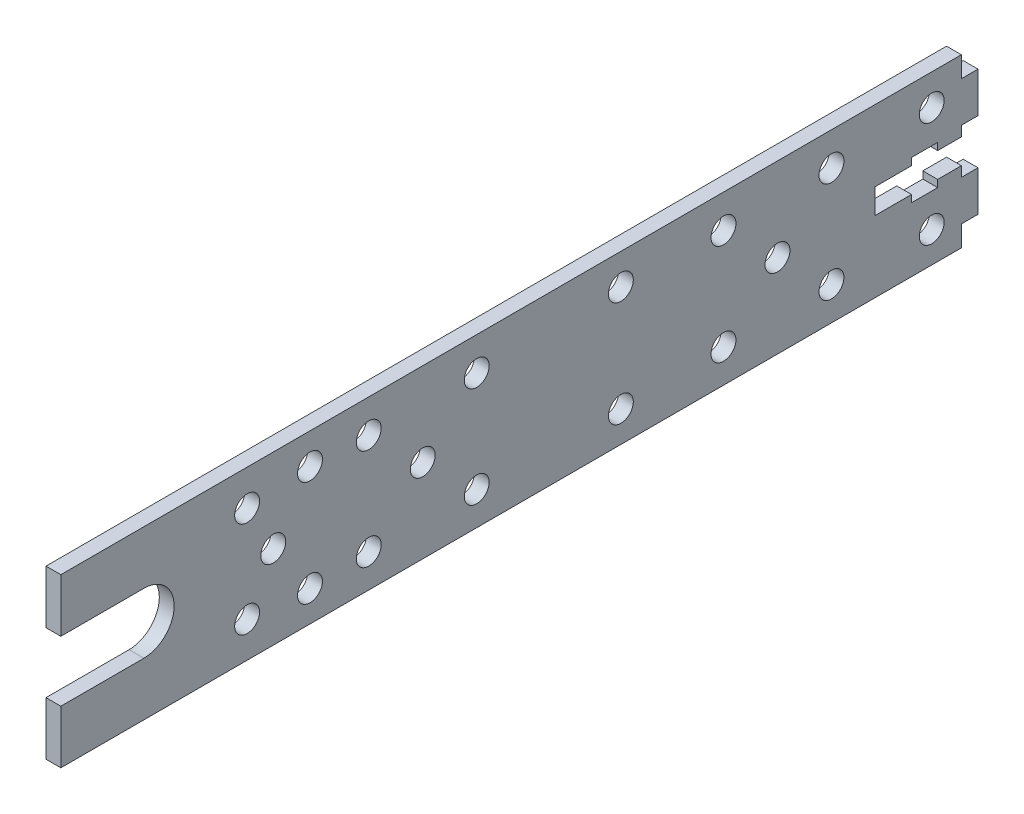
from build123d import *

# Parameters (mm, degrees)
SKETCH1_R           = 2.667
BOSS_EXTRUDE1_DEPTH = 1.5875


with BuildPart() as part:
    # Sketch1 → Boss-Extrude1 (new, symmetric)
    with BuildSketch(Plane(origin=(0, 0, 0), x_dir=(0, 0, -1), z_dir=(1, 0, 0))):
        with BuildLine():
            Line((94.615, 17.907), (-98.171, 17.907))
            Line((-98.171, 17.907), (-98.171, 6.477))
            Line((-98.171, 6.477), (-80.391, 6.477))
            ThreePointArc((-80.391, 6.477), (-73.914, 0), (-80.391, -6.477))
            Line((-80.391, -6.477), (-98.171, -6.477))
            Line((-98.171, -6.477), (-98.171, -17.907))
            Line((-98.171, -17.907), (94.615, -17.907))
            Line((94.615, -17.907), (94.615, -13.462))
            Line((94.615, -13.462), (98.171, -13.462))
            Line((98.171, -13.462), (98.171, -4.826))
            Line((98.171, -4.826), (94.615, -4.826))
            Line((94.615, -4.826), (94.615, -2.667))
            Line((94.615, -2.667), (89.535, -2.667))
            Line((89.535, -2.667), (89.535, -4.191))
            Line((89.535, -4.191), (83.947, -4.191))
            Line((83.947, -4.191), (83.947, -2.667))
            Line((83.947, -2.667), (76.073, -2.667))
            Line((76.073, -2.667), (76.073, 2.667))
            Line((76.073, 2.667), (83.947, 2.667))
            Line((83.947, 2.667), (83.947, 4.191))
            Line((83.947, 4.191), (89.535, 4.191))
            Line((89.535, 4.191), (89.535, 2.667))
            Line((89.535, 2.667), (94.615, 2.667))
            Line((94.615, 2.667), (94.615, 4.826))
            Line((94.615, 4.826), (98.171, 4.826))
            Line((98.171, 4.826), (98.171, 13.462))
            Line((98.171, 13.462), (94.615, 13.462))
            Line((94.615, 13.462), (94.615, 17.907))
        make_face()
        with Locations((-58.293, -10.287)):
            Circle(SKETCH1_R, mode=Mode.SUBTRACT)
        with Locations((-44.831, -11.303)):
            Circle(SKETCH1_R, mode=Mode.SUBTRACT)
        with Locations((-32.258, -10.795)):
            Circle(SKETCH1_R, mode=Mode.SUBTRACT)
        with Locations((-9.144, -10.795)):
            Circle(SKETCH1_R, mode=Mode.SUBTRACT)
        with Locations((-52.705, 0)):
            Circle(SKETCH1_R, mode=Mode.SUBTRACT)
        with Locations((-20.701, 0)):
            Circle(SKETCH1_R, mode=Mode.SUBTRACT)
        with Locations((21.717, -11.303)):
            Circle(SKETCH1_R, mode=Mode.SUBTRACT)
        with Locations((43.688, -10.795)):
            Circle(SKETCH1_R, mode=Mode.SUBTRACT)
        with Locations((66.802, -10.795)):
            Circle(SKETCH1_R, mode=Mode.SUBTRACT)
        with Locations((88.265, -11.303)):
            Circle(SKETCH1_R, mode=Mode.SUBTRACT)
        with Locations((55.245, 0)):
            Circle(SKETCH1_R, mode=Mode.SUBTRACT)
        with Locations((-58.293, 10.287)):
            Circle(SKETCH1_R, mode=Mode.SUBTRACT)
        with Locations((-32.258, 10.795)):
            Circle(SKETCH1_R, mode=Mode.SUBTRACT)
        with Locations((-44.831, 11.303)):
            Circle(SKETCH1_R, mode=Mode.SUBTRACT)
        with Locations((-9.144, 10.795)):
            Circle(SKETCH1_R, mode=Mode.SUBTRACT)
        with Locations((21.717, 11.303)):
            Circle(SKETCH1_R, mode=Mode.SUBTRACT)
        with Locations((43.688, 10.795)):
            Circle(SKETCH1_R, mode=Mode.SUBTRACT)
        with Locations((66.802, 10.795)):
            Circle(SKETCH1_R, mode=Mode.SUBTRACT)
        with Locations((88.265, 11.303)):
            Circle(SKETCH1_R, mode=Mode.SUBTRACT)
    extrude(amount=BOSS_EXTRUDE1_DEPTH, both=True)


solid = part.part
